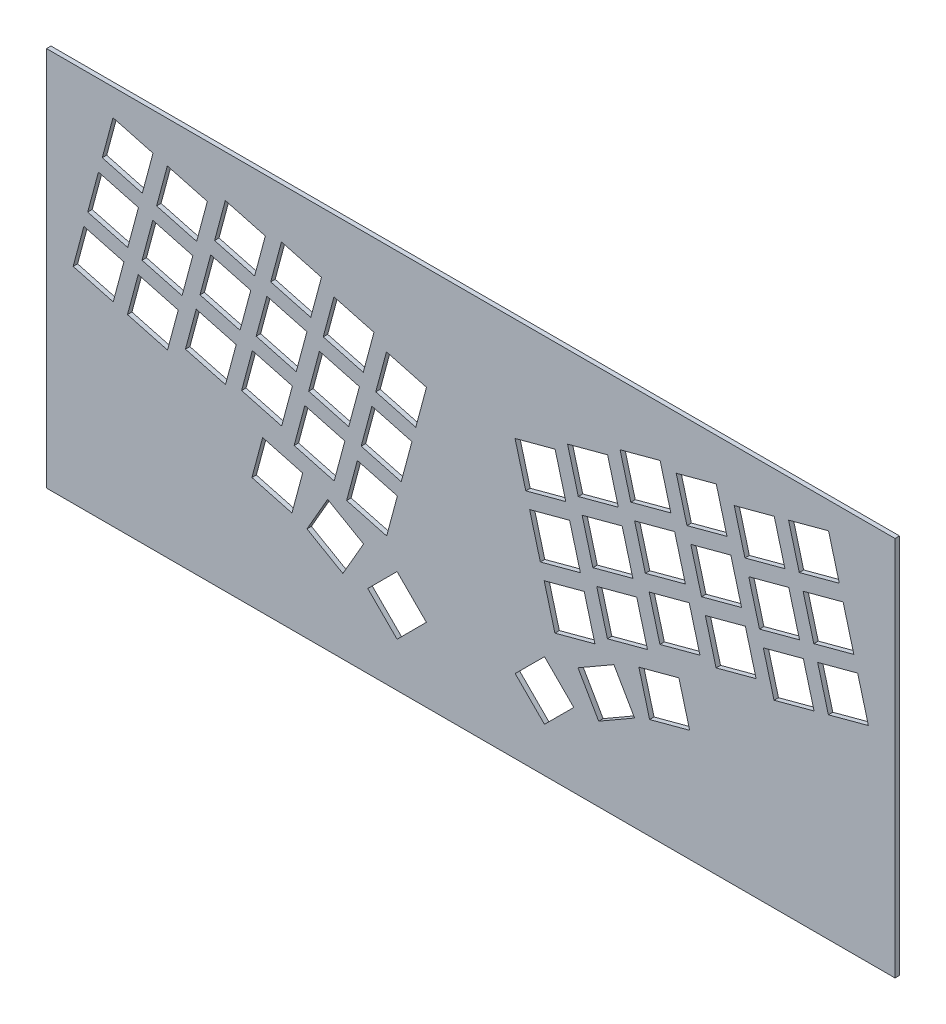
from build123d import *

# Parameters (mm, degrees)
SKETCH2_W               = 286.650155902
SKETCH2_H               = 128.591626938
BASE_FLANGE1_DEPTH      = 1.5
LH_SWITCH_CUTOUTS_DEPTH = 10


# Sheet-metal steps are written as plain solids
with BuildPart() as part:
    # Sketch2 → Base-Flange1 (new body)
    with BuildSketch(Plane.XY):
        with Locations((0, -6.073258719)):
            Rectangle(SKETCH2_W, SKETCH2_H)
    extrude(amount=-BASE_FLANGE1_DEPTH)

    # Sketch7 → LH switch cutouts (cut)
    with BuildSketch(Plane.XY):
        Polygon((-125.783700663, 30.868662315), (-112.260739095, 27.245195683), (-115.884205727, 13.722234115), (-129.407167295, 17.345700747), align=None)
        Polygon((-120.865790007, 49.22255475), (-107.342828439, 45.599088118), (-110.966295071, 32.07612655), (-124.489256639, 35.699593182), align=None)
        Polygon((-112.347228159, 7.596727734), (-98.824266591, 3.973261103), (-102.447733222, -9.549700465), (-115.97069479, -5.926233834), align=None)
        Polygon((-107.429317503, 25.950620169), (-93.906355935, 22.327153538), (-97.529822566, 8.80419197), (-111.052784134, 12.427658601), align=None)
        Polygon((-102.511406847, 44.304512604), (-88.988445279, 40.681045973), (-92.61191191, 27.158084405), (-106.134873478, 30.781551036), align=None)
        Polygon((-130.701611319, 12.514769879), (-117.178649751, 8.891303248), (-120.802116382, -4.63165832), (-134.325077951, -1.008191689), align=None)
        Polygon((-92.76385806, 7.267290187), (-79.240896492, 3.643823555), (-82.864363123, -9.879138013), (-96.387324691, -6.255671381), align=None)
        Polygon((-87.845947404, 25.621182622), (-74.322985836, 21.997715991), (-77.946452467, 8.474754423), (-91.469414035, 12.098221054), align=None)
        Polygon((-82.928036748, 43.975075057), (-69.40507518, 40.351608426), (-73.028541811, 26.828646858), (-86.551503379, 30.452113489), align=None)
        Polygon((-73.795226792, 4.643616085), (-60.272265224, 1.020149454), (-63.895731856, -12.502812114), (-77.418693424, -8.879345483), align=None)
        Polygon((-68.877316136, 22.99750852), (-55.354354568, 19.374041889), (-58.9778212, 5.851080321), (-72.500782768, 9.474546952), align=None)
        Polygon((-63.959405481, 41.351400956), (-50.436443912, 37.727934324), (-54.059910544, 24.204972756), (-67.582872112, 27.828439388), align=None)
        Polygon((-56.056073189, -2.568531125), (-42.533111621, -6.191997756), (-46.156578253, -19.714959325), (-59.679539821, -16.091492693), align=None)
        Polygon((-51.138162533, 15.78536131), (-37.615200965, 12.161894679), (-41.238667597, -1.361066889), (-54.761629165, 2.262399742), align=None)
        Polygon((-46.220251877, 34.139253745), (-32.697290309, 30.515787114), (-36.320756941, 16.992825546), (-49.843718509, 20.616292177), align=None)
        Polygon((-38.316919586, -9.780678335), (-24.793958018, -13.404144967), (-28.417424649, -26.927106535), (-41.940386218, -23.303639903), align=None)
        Polygon((-33.39900893, 8.5732141), (-19.876047362, 4.949747468), (-23.499513994, -8.5732141), (-37.022475562, -4.949747468), align=None)
        Polygon((-28.481098274, 26.927106535), (-14.958136706, 23.303639903), (-18.581603338, 9.780678335), (-32.104564906, 13.404144967), align=None)
        Polygon((-24.906247495, -35.570086924), (-34.798985264, -45.476334418), (-24.892737769, -55.369072188), (-15, -45.462824693), align=None)
        Polygon((-48.35341338, -26.175764594), (-55.341091589, -38.307225893), (-43.209630291, -45.294904102), (-36.221952081, -33.163442803), align=None)
        Polygon((-70.31270344, -19.067214694), (-56.789741872, -22.690681325), (-60.413208503, -36.213642893), (-73.936170071, -32.590176262), align=None)
    lh_switch_cutouts = extrude(amount=-LH_SWITCH_CUTOUTS_DEPTH, mode=Mode.SUBTRACT)

    # RH switch cutouts: LH switch cutouts across plane
    add(lh_switch_cutouts.mirror(Plane(origin=(0, 0, 0), x_dir=(0, 0, 1), z_dir=(1, 0, 0))), mode=Mode.SUBTRACT)


solid = part.part
